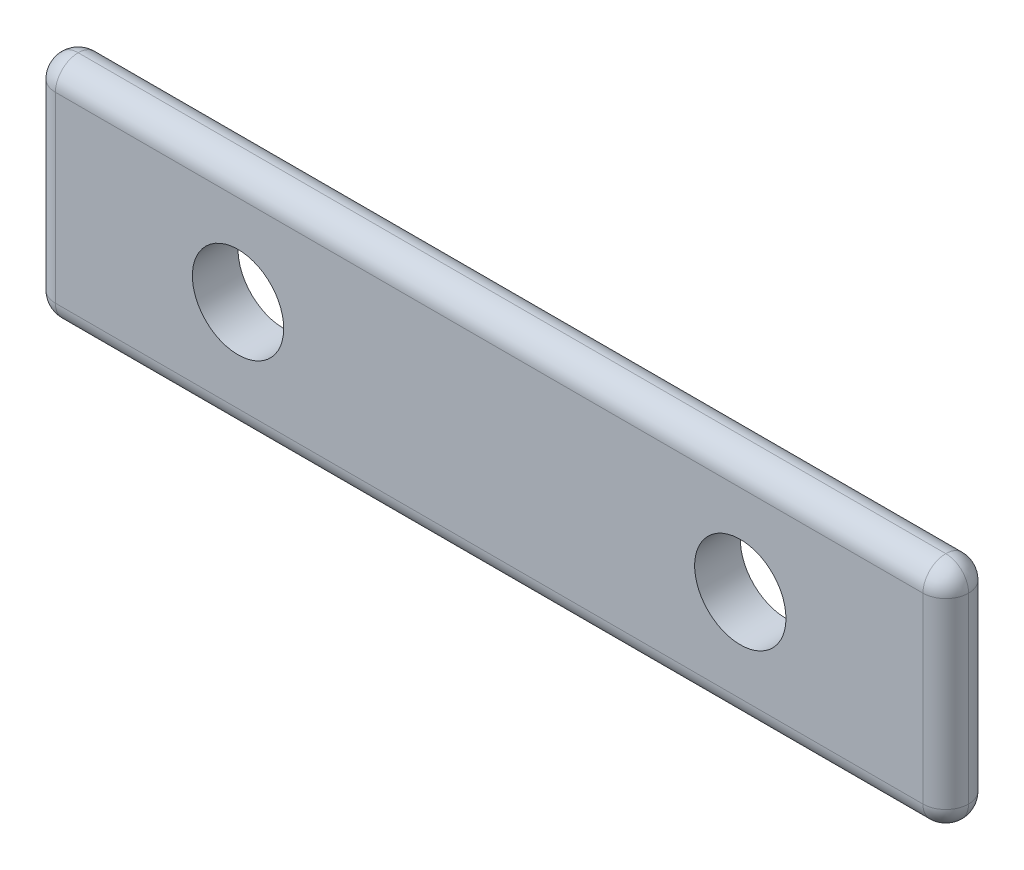
from build123d import *

# Parameters (mm, degrees)
ESBO_O1_W                = 200
ESBO_O1_H                = 50
RESSALTO_EXTRUS_O1_DEPTH = 10
FILETE1_R                = 5
FUROS_GUIA_COM_20_0MM1_D = 20


with BuildPart() as part:
    # Esboço1 → Ressalto-extrusão1 (new body)
    with BuildSketch(Plane.XY):
        with Locations((100, 25)):
            Rectangle(ESBO_O1_W, ESBO_O1_H)
    extrude(amount=RESSALTO_EXTRUS_O1_DEPTH)

    # Filete1
    filete1_edges = [part.edges().sort_by_distance(p)[0] for p in [
        (100, 50, 10),
        (0, 25, 10),
        (100, 0, 10),
        (0, 25, 0),
        (100, 50, 0),
        (200, 25, 0),
        (100, 0, 0),
        (0, 0, 5),
        (0, 50, 5),
        (200, 50, 5),
        (200, 0, 5),
        (200, 25, 10),
    ]]
    fillet(filete1_edges, radius=FILETE1_R - 0.0001)  # a hair under: the kernel refuses the full size

    # Furos-guia com Ø20.0mm1 (through all)
    with Locations(Plane.XY.offset(10)):
        with Locations((45, 25.206865572), (155, 25.206865572)):
            Hole(FUROS_GUIA_COM_20_0MM1_D / 2)


solid = part.part
